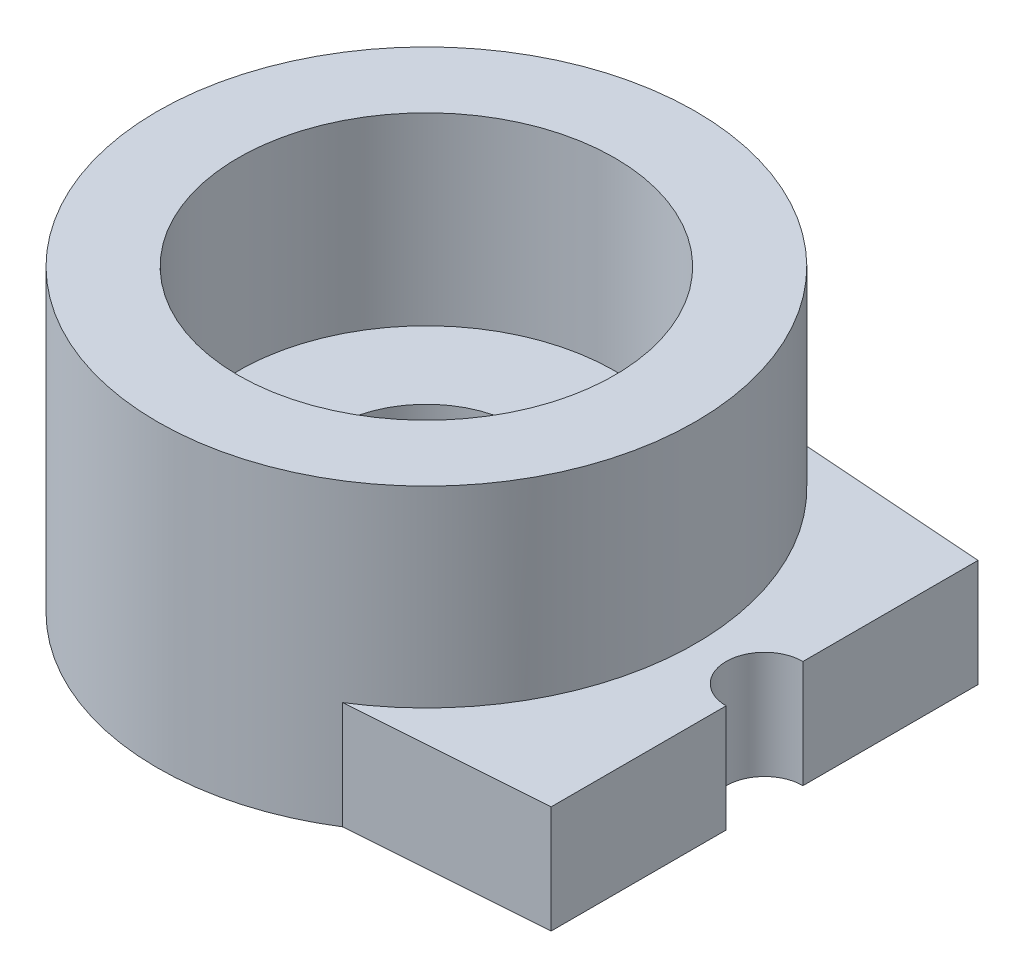
from build123d import *

# Parameters (mm, degrees)
SKETCH1_R               = 0.5
BOSS_EXTRUDE1_DEPTH     = 1.4
SKETCH2_R               = 2.35
CUT_EXTRUDE1_DEPTH      = 1
SKETCH3_R               = 3.5
SKETCH3_R_2             = 2.45
BOSS_EXTRUDE2_DEPTH     = 2.5
SKETCH4_R               = 1.2
CUT_EXTRUDE2_DEPTH      = 20.282440198
SKETCH5_R               = 2.45
SKETCH5_R_2             = 1.2
BOSS_EXTRUDE3_DEPTH     = 0.1
SKETCH6_W               = 35.735260114
SKETCH6_H               = 17.672039004
CUT_EXTRUDE4_DEPTH      = 20.513392837
CUT_EXTRUDE5_DEPTH      = 18.980545042
CUT_EXTRUDE_START       = -1.4
CUT_EXTRUDE_1_OUTLINE_R = 0.5
CUT_EXTRUDE_1_DEPTH     = 1.4


# Read off the part's stored shape, not the designer's step: 切除-拉伸-薄壁1
with BuildPart() as part:
    # Sketch1 → Boss-Extrude1 (new body)
    with BuildSketch(Plane(origin=(0, 0, 0), x_dir=(1, 0, 0), z_dir=(0, 1, 0))):
        with BuildLine():
            Line((-15.2, 2), (-2, 2.95))
            Line((-2, 2.95), (-2, 6.35))
            ThreePointArc((-2, 6.35), (0, 8.35), (2, 6.35))
            Line((2, 6.35), (2, 3.5))
            Line((2, 3.5), (15.2, 2))
            ThreePointArc((15.2, 2), (17.2, 0), (15.2, -2))
            Line((15.2, -2), (2, -3.5))
            Line((2, -3.5), (2, -6.35))
            ThreePointArc((2, -6.35), (0, -8.35), (-2, -6.35))
            Line((-2, -6.35), (-2, -2.95))
            Line((-2, -2.95), (-15.2, -2))
            ThreePointArc((-15.2, -2), (-17.2, 0), (-15.2, 2))
        make_face()
        with Locations((0, 6.35)):
            Circle(SKETCH1_R, mode=Mode.SUBTRACT)
        with Locations((0, 4.55)):
            Circle(SKETCH1_R, mode=Mode.SUBTRACT)
        with Locations((0, -4.55)):
            Circle(SKETCH1_R, mode=Mode.SUBTRACT)
        with Locations((0, -6.35)):
            Circle(SKETCH1_R, mode=Mode.SUBTRACT)
        with Locations((-15.2, 0)):
            Circle(SKETCH1_R, mode=Mode.SUBTRACT)
        with Locations(Location((15.2, 0, 0), (0, 0, 270))):
            Circle(SKETCH1_R, mode=Mode.SUBTRACT)
        with Locations((-13.4, 0)):
            Circle(SKETCH1_R, mode=Mode.SUBTRACT)
        with Locations((-11.6, 0)):
            Circle(SKETCH1_R, mode=Mode.SUBTRACT)
        with Locations((-9.8, 0)):
            Circle(SKETCH1_R, mode=Mode.SUBTRACT)
        with Locations((-8, 0)):
            Circle(SKETCH1_R, mode=Mode.SUBTRACT)
        with Locations((-6.2, 0)):
            Circle(SKETCH1_R, mode=Mode.SUBTRACT)
        with Locations((-4.4, 0)):
            Circle(SKETCH1_R, mode=Mode.SUBTRACT)
        with Locations(Location((13.4, 0, 0), (0, 0, 270))):
            Circle(SKETCH1_R, mode=Mode.SUBTRACT)
        with Locations(Location((11.6, 0, 0), (0, 0, 270))):
            Circle(SKETCH1_R, mode=Mode.SUBTRACT)
        with Locations(Location((9.8, 0, 0), (0, 0, 270))):
            Circle(SKETCH1_R, mode=Mode.SUBTRACT)
        with Locations(Location((8, 0, 0), (0, 0, 270))):
            Circle(SKETCH1_R, mode=Mode.SUBTRACT)
        with Locations(Location((6.2, 0, 0), (0, 0, 270))):
            Circle(SKETCH1_R, mode=Mode.SUBTRACT)
        with Locations(Location((4.4, 0, 0), (0, 0, 270))):
            Circle(SKETCH1_R, mode=Mode.SUBTRACT)
    extrude(amount=BOSS_EXTRUDE1_DEPTH)

    # Sketch2 → Cut-Extrude1 (cut)
    with BuildSketch(Plane.XZ):
        with Locations(Location((0, 0, 0), (0, 0, 270))):
            Circle(SKETCH2_R)
    extrude(amount=-CUT_EXTRUDE1_DEPTH, mode=Mode.SUBTRACT)

    # Sketch3 → Boss-Extrude2 (add)
    with BuildSketch(Plane(origin=(0, 1.4, 0), x_dir=(1, 0, 0), z_dir=(0, 1, 0))):
        with Locations(Location((0, 0, 0), (0, 0, 57.731921145))):
            Circle(SKETCH3_R)
        with Locations(Location((0, 0, 0), (0, 0, 270))):
            Circle(SKETCH3_R_2, mode=Mode.SUBTRACT)
    extrude(amount=BOSS_EXTRUDE2_DEPTH)

    # Sketch4 → Cut-Extrude2 (cut, through all)
    with BuildSketch(Plane(origin=(0, 1.4, 0), x_dir=(1, 0, 0), z_dir=(0, 1, 0))):
        with Locations(Location((0, 0, 0), (0, 0, 270))):
            Circle(SKETCH4_R)
    extrude(amount=-CUT_EXTRUDE2_DEPTH, mode=Mode.SUBTRACT)

    # Sketch5 → Boss-Extrude3 (add)
    with BuildSketch(Plane(origin=(0, 1.4, 0), x_dir=(1, 0, 0), z_dir=(0, 1, 0))):
        with Locations(Location((0, 0, 0), (0, 0, 270))):
            Circle(SKETCH5_R)
        with Locations(Location((0, 0, 0), (0, 0, 270))):
            Circle(SKETCH5_R_2, mode=Mode.SUBTRACT)
    extrude(amount=BOSS_EXTRUDE3_DEPTH)

    # Sketch6 → Cut-Extrude4 (cut, through all)
    with BuildSketch(Plane.XZ):
        Rectangle(SKETCH6_W, SKETCH6_H)
        with BuildLine():
            Line((-1.868584713, -2.959457918), (-15.2, -2))
            ThreePointArc((-15.2, -2), (-17.2, 0), (-15.2, 2))
            Line((-15.2, 2), (-1.868584713, 2.959457918))
            ThreePointArc((-1.868584713, 2.959457918), (0, 3.5), (1.868584713, 2.959457918))
            Line((1.868584713, 2.959457918), (15.2, 2))
            ThreePointArc((15.2, 2), (17.2, 0), (15.2, -2))
            Line((15.2, -2), (1.868584713, -2.959457918))
            ThreePointArc((1.868584713, -2.959457918), (0, -3.5), (-1.868584713, -2.959457918))
        make_face(mode=Mode.SUBTRACT)
    extrude(amount=-CUT_EXTRUDE4_DEPTH, mode=Mode.SUBTRACT)

    # Sketch7 → Cut-Extrude5 (cut, through all)
    with BuildSketch(Plane.XZ):
        with BuildLine():
            Line((0, 3.5), (-17.731768104, 3.5))
            Line((-17.731768104, 3.5), (-17.731768104, -3.5))
            Line((-17.731768104, -3.5), (0, -3.5))
            ThreePointArc((0, -3.5), (-3.5, 0), (0, 3.5))
        make_face()
    extrude(amount=-CUT_EXTRUDE5_DEPTH, mode=Mode.SUBTRACT)

    # 切除-拉伸-薄壁1 outline → 切除-拉伸-薄壁1 (cut)
    with BuildSketch(Plane(origin=(0, 0, 0), x_dir=(-1, 0, 0), z_dir=(0, -1, 0)).offset(CUT_EXTRUDE_START)):
        with BuildLine():
            Line((-4.4, -2.777272727), (-4.4, -0.5))
            ThreePointArc((-4.4, -0.5), (-4.9, 0), (-4.4, 0.5))
            Line((-4.4, 0.5), (-4.4, 2.777272727))
            Line((-4.4, 2.777272727), (-15.2, 2))
            ThreePointArc((-15.2, 2), (-17.2, 0), (-15.2, -2))
            Line((-15.2, -2), (-4.4, -2.777272727))
        make_face()
        with Locations((-15.2, 0)):
            Circle(CUT_EXTRUDE_1_OUTLINE_R, mode=Mode.SUBTRACT)
        with Locations((-13.4, 0)):
            Circle(CUT_EXTRUDE_1_OUTLINE_R, mode=Mode.SUBTRACT)
        with Locations((-11.6, 0)):
            Circle(CUT_EXTRUDE_1_OUTLINE_R, mode=Mode.SUBTRACT)
        with Locations((-9.8, 0)):
            Circle(CUT_EXTRUDE_1_OUTLINE_R, mode=Mode.SUBTRACT)
        with Locations((-8, 0)):
            Circle(CUT_EXTRUDE_1_OUTLINE_R, mode=Mode.SUBTRACT)
        with Locations((-6.2, 0)):
            Circle(CUT_EXTRUDE_1_OUTLINE_R, mode=Mode.SUBTRACT)
    extrude(amount=CUT_EXTRUDE_1_DEPTH, mode=Mode.SUBTRACT)


solid = part.part
